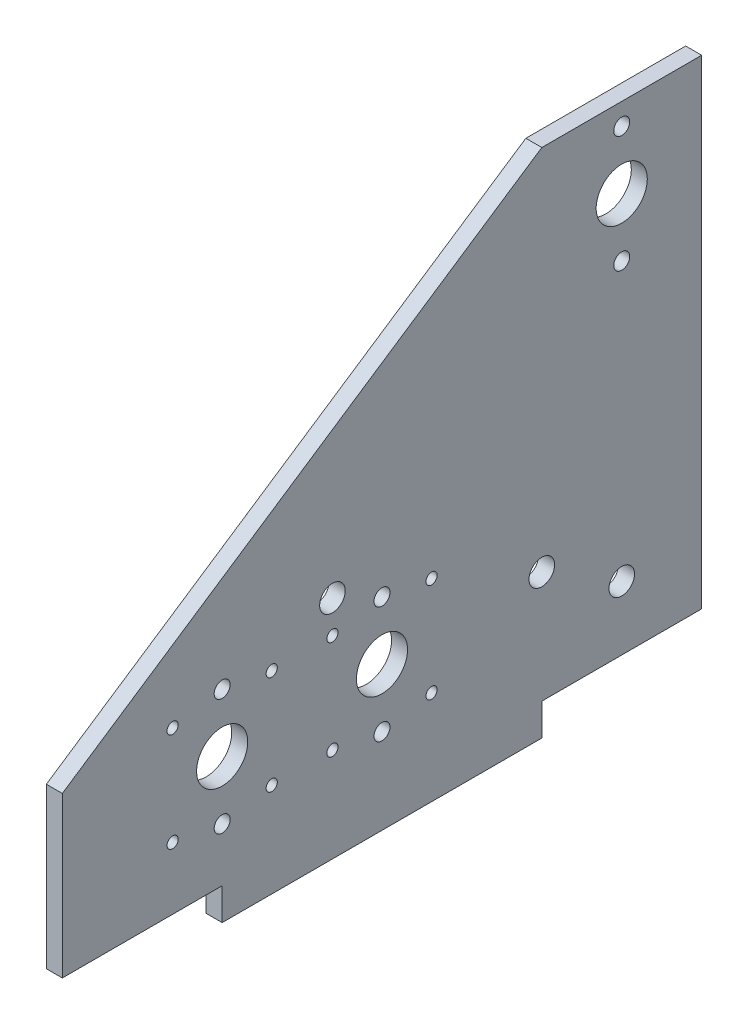
from build123d import *

# Parameters (mm, degrees)
CROQUIS1_R              = 8
CROQUIS1_R_2            = 4
CROQUIS1_R_3            = 2.5
CROQUIS1_R_4            = 1.75
SALIENTE_EXTRUIR1_DEPTH = 5


with BuildPart() as part:
    # Croquis1 → Saliente-Extruir1 (new body)
    with BuildSketch(Plane(origin=(0, 0, 0), x_dir=(0, 0, -1), z_dir=(1, 0, 0))):
        Polygon((150, 150), (0, 50), (0, 0), (50, 0), (50, -10), (150, -10), (150, 0), (200, 0), (200, 150), align=None)
        with Locations((175, 125)):
            Circle(CROQUIS1_R, mode=Mode.SUBTRACT)
        with Locations((175, 20)):
            Circle(CROQUIS1_R_2, mode=Mode.SUBTRACT)
        with Locations((150, 35)):
            Circle(CROQUIS1_R_2, mode=Mode.SUBTRACT)
        with Locations((175, 143.25)):
            Circle(CROQUIS1_R_3, mode=Mode.SUBTRACT)
        with Locations((175, 106.75)):
            Circle(CROQUIS1_R_3, mode=Mode.SUBTRACT)
        with Locations((100, 35)):
            Circle(CROQUIS1_R, mode=Mode.SUBTRACT)
        with Locations((84.5, 60.685599078)):
            Circle(CROQUIS1_R_2, mode=Mode.SUBTRACT)
        with Locations((100, 53.25)):
            Circle(CROQUIS1_R_3, mode=Mode.SUBTRACT)
        with Locations((100, 16.75)):
            Circle(CROQUIS1_R_3, mode=Mode.SUBTRACT)
        with Locations((84.5, 50.5)):
            Circle(CROQUIS1_R_4, mode=Mode.SUBTRACT)
        with Locations((115.5, 50.5)):
            Circle(CROQUIS1_R_4, mode=Mode.SUBTRACT)
        with Locations((115.5, 19.5)):
            Circle(CROQUIS1_R_4, mode=Mode.SUBTRACT)
        with Locations((84.5, 19.5)):
            Circle(CROQUIS1_R_4, mode=Mode.SUBTRACT)
        with Locations((50, 35)):
            Circle(CROQUIS1_R, mode=Mode.SUBTRACT)
        with Locations((50, 53.25)):
            Circle(CROQUIS1_R_3, mode=Mode.SUBTRACT)
        with Locations((50, 16.75)):
            Circle(CROQUIS1_R_3, mode=Mode.SUBTRACT)
        with Locations((34.5, 50.5)):
            Circle(CROQUIS1_R_4, mode=Mode.SUBTRACT)
        with Locations((65.5, 50.5)):
            Circle(CROQUIS1_R_4, mode=Mode.SUBTRACT)
        with Locations((65.5, 19.5)):
            Circle(CROQUIS1_R_4, mode=Mode.SUBTRACT)
        with Locations((34.5, 19.5)):
            Circle(CROQUIS1_R_4, mode=Mode.SUBTRACT)
    extrude(amount=SALIENTE_EXTRUIR1_DEPTH)


solid = part.part
